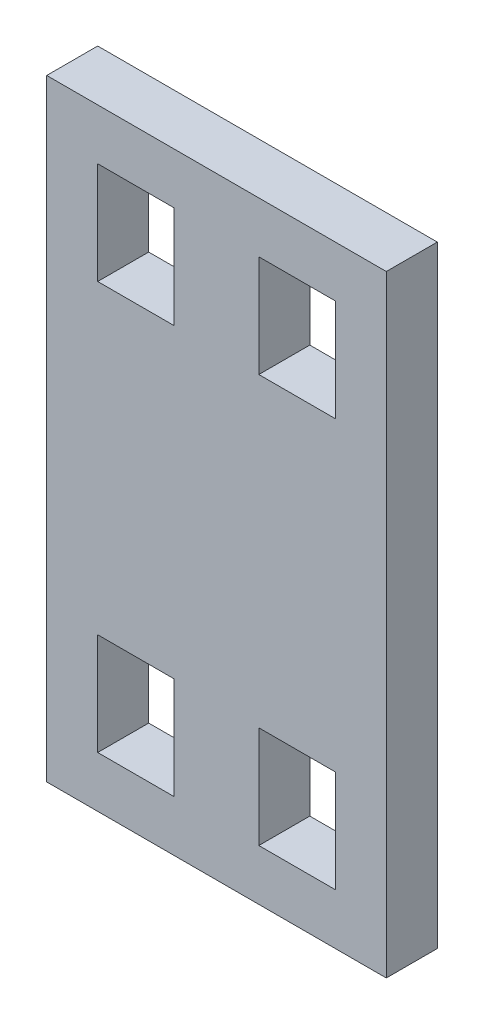
from build123d import *

# Parameters (mm, degrees)
SKETCH1_W           = 76.2
SKETCH1_H           = 42.291
BOSS_EXTRUDE1_DEPTH = 6.35
SKETCH2_W           = 9.525
SKETCH2_H           = 12.7
CUT_EXTRUDE1_DEPTH  = 88.380153244


with BuildPart() as part:
    # Sketch1 → Boss-Extrude1 (new body)
    with BuildSketch(Plane(origin=(0, 0, 0), x_dir=(0, 1, 0), z_dir=(0, 0, 1))):
        with Locations((38.1, 21.1455)):
            Rectangle(SKETCH1_W, SKETCH1_H)
    extrude(amount=BOSS_EXTRUDE1_DEPTH)

    # Sketch2 → Cut-Extrude1 (cut, through all)
    with BuildSketch(Plane.XY.offset(6.35)):
        with Locations((-31.1785, 12.7)):
            Rectangle(SKETCH2_W, SKETCH2_H)
        with Locations((-11.1125, 63.5)):
            Rectangle(SKETCH2_W, SKETCH2_H)
        with Locations((-31.1785, 63.5)):
            Rectangle(SKETCH2_W, SKETCH2_H)
        with Locations((-11.1125, 12.7)):
            Rectangle(SKETCH2_W, SKETCH2_H)
    extrude(amount=-CUT_EXTRUDE1_DEPTH, mode=Mode.SUBTRACT)


solid = part.part
